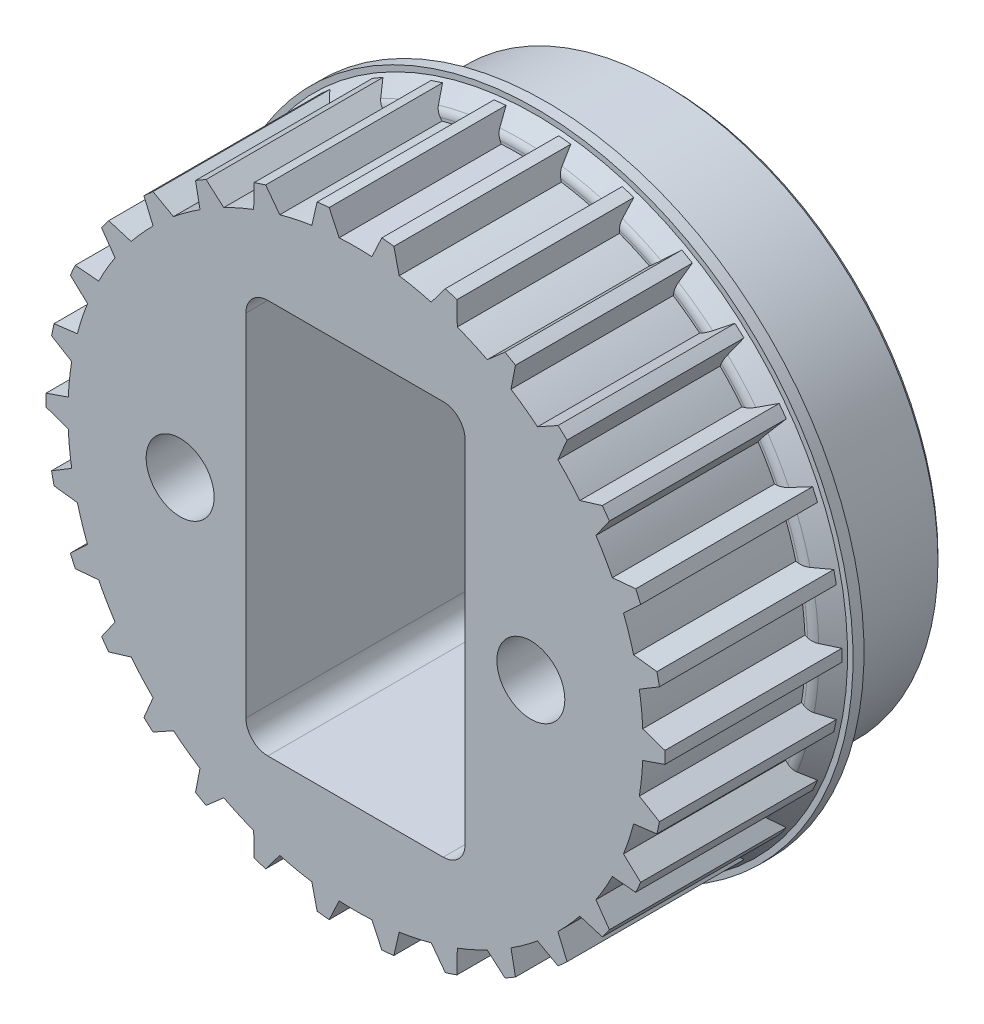
from build123d import *

# Parameters (mm, degrees)
SCHNITT_LINEAR_AUSTRAGEN1_DEPTH      = 23.265922393
KREISMUSTER1_COUNT                   = 30
SCHNITT_LINEAR_AUSTRAGEN2_DEPTH      = 23.749120862
SCHNITT_LINEAR_AUSTRAGEN2_DEPTH_BACK = 23.749120862
SKIZZE4_R                            = 1.55
VERRUNDUNG1_R                        = 1.2
FASE1_SIZE                           = 0.2


with BuildPart() as part:
    # Skizze1 → Rotation1 (revolve)
    with BuildSketch(Plane(origin=(0, 0, 0), x_dir=(0, 0, -1), z_dir=(1, 0, 0))):
        Polygon((-4.35, 14.12), (4.35, 14.12), (4.35, 12.575), (9.85, 12.575), (9.85, 0), (-4.35, 0), (-4.35, 12.575), align=None)
    revolve(axis=Axis((0, 0, 46.515199561), (0, 0, -1)))

    # Skizze2 → Schnitt-Linear austragen1 (cut, symmetric)
    with BuildSketch(Plane.XY):
        with BuildLine():
            Line((-1.2, 14.068916092), (-0.747573546, 13.09868443))
            ThreePointArc((-0.747573546, 13.09868443), (0, 13.12), (0.747573546, 13.09868443))
            Line((0.747573546, 13.09868443), (1.2, 14.068916092))
            ThreePointArc((1.2, 14.068916092), (0, 14.12), (-1.2, 14.068916092))
        make_face()
    schnitt_linear_austragen1 = extrude(amount=SCHNITT_LINEAR_AUSTRAGEN1_DEPTH, both=True, mode=Mode.SUBTRACT)

    # Kreismuster1: Schnitt-Linear austragen1 ×30 about axis
    kreismuster1_axis = Axis((0, 0, 9.02), (0, 0, -1))
    for i in range(1, KREISMUSTER1_COUNT):
        add(schnitt_linear_austragen1.rotate(kreismuster1_axis, i * 360 / KREISMUSTER1_COUNT), mode=Mode.SUBTRACT)

    # Skizze3 → Rotation2 (revolve)
    with BuildSketch(Plane(origin=(0, 0, 0), x_dir=(0, 0, -1), z_dir=(1, 0, 0))):
        with BuildLine():
            Line((4.35, 13), (4.35, 14.5))
            Line((4.35, 14.5), (3.85, 14.5))
            Line((3.85, 14.5), (3.85, 14.25))
            Line((3.85, 14.25), (3.196446609, 13.596446609))
            ThreePointArc((3.196446609, 13.596446609), (3.088060234, 13.434234935), (3.05, 13.242893219))
            Line((3.05, 13.242893219), (3.05, 13))
            Line((3.05, 13), (4.35, 13))
        make_face()
    revolve(axis=Axis((0, 0, -11.03129214), (0, 0, 1)))

    # Skizze4 → Schnitt-Linear austragen2 (cut, two sides: drawn at the far end of the back side and taken through both)
    with BuildSketch(Plane.XY.offset(-SCHNITT_LINEAR_AUSTRAGEN2_DEPTH_BACK)):
        with Locations((-8, 0)):
            Circle(SKIZZE4_R)
        with Locations((8, 0)):
            Circle(SKIZZE4_R)
        with BuildLine():
            Line((4, 9), (-4, 9))
            ThreePointArc((-4, 9), (-4.707106781, 8.707106781), (-5, 8))
            Line((-5, 8), (-5, -8))
            ThreePointArc((-5, -8), (-4.707106781, -8.707106781), (-4, -9))
            Line((-4, -9), (4, -9))
            ThreePointArc((4, -9), (4.707106781, -8.707106781), (5, -8))
            Line((5, -8), (5, 8))
            ThreePointArc((5, 8), (4.707106781, 8.707106781), (4, 9))
        make_face()
    extrude(amount=SCHNITT_LINEAR_AUSTRAGEN2_DEPTH + SCHNITT_LINEAR_AUSTRAGEN2_DEPTH_BACK, mode=Mode.SUBTRACT)

    # Verrundung1
    verrundung1_edges = [part.edges().sort_by_distance(p)[0] for p in [
        (-4.707106781, 8.707106781, -9.85),
        (0, 9, -9.85),
        (4.707106781, 8.707106781, -9.85),
        (5, 0, -9.85),
        (4.707106781, -8.707106781, -9.85),
        (0, -9, -9.85),
        (-4.707106781, -8.707106781, -9.85),
        (-5, 0, -9.85),
    ]]
    fillet(verrundung1_edges, radius=VERRUNDUNG1_R)

    # Fase1
    fase1_edges = [part.edges().sort_by_distance(p)[0] for p in [
        (-9.55, 0, -9.85),
        (6.45, 0, -9.85),
        (0, -12.575, -9.85),
    ]]
    chamfer(fase1_edges, length=FASE1_SIZE)


solid = part.part
